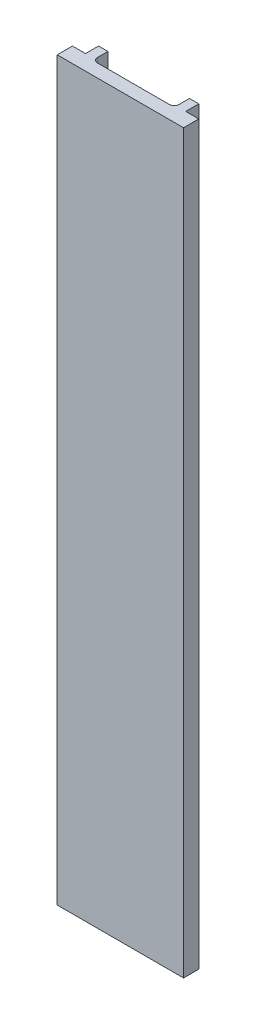
from build123d import *

# Parameters (mm, degrees)
SKETCH1_W                                  = 29
SKETCH1_H                                  = 6.5
TOP_PIECE_WITH_RIDGES_DEPTH                = 169
SUBTRACT_ACTUATOR_AND_BOTTOM_MOLD_OUTLIN_W = 3
SUBTRACT_ACTUATOR_AND_BOTTOM_MOLD_OUTLIN_H = 3
SUBTRACT_ACTUATOR_AND_BOTTOM_MOLD_DEPTH    = 169


# Read off the part's stored shape, not the designer's step: subtract actuator and bottom mold
with BuildPart() as part:
    # Sketch1 → top piece with ridges (new body)
    with BuildSketch(Plane(origin=(0, 0, 0), x_dir=(1, 0, 0), z_dir=(0, 1, 0))):
        with Locations((14.5, 3.25)):
            Rectangle(SKETCH1_W, SKETCH1_H)
    extrude(amount=TOP_PIECE_WITH_RIDGES_DEPTH)

    # subtract actuator and bottom mold outlin → subtract actuator and bottom mold (cut)
    with BuildSketch(Plane(origin=(0, 0, 0), x_dir=(1, 0, 0), z_dir=(0, 1, 0))):
        with Locations((27.5, 5)):
            Rectangle(SUBTRACT_ACTUATOR_AND_BOTTOM_MOLD_OUTLIN_W, SUBTRACT_ACTUATOR_AND_BOTTOM_MOLD_OUTLIN_H)
        with BuildLine():
            Line((23.85, 6.5), (5.15, 6.5))
            Line((5.15, 6.5), (5.15, 4.1))
            ThreePointArc((5.15, 4.1), (5.472182541, 3.322182541), (6.25, 3))
            Line((6.25, 3), (22.75, 3))
            ThreePointArc((22.75, 3), (23.527817459, 3.322182541), (23.85, 4.1))
            Line((23.85, 4.1), (23.85, 6.5))
        make_face()
        with Locations((1.5, 5)):
            Rectangle(SUBTRACT_ACTUATOR_AND_BOTTOM_MOLD_OUTLIN_W, SUBTRACT_ACTUATOR_AND_BOTTOM_MOLD_OUTLIN_H)
    extrude(amount=SUBTRACT_ACTUATOR_AND_BOTTOM_MOLD_DEPTH, mode=Mode.SUBTRACT)


solid = part.part
